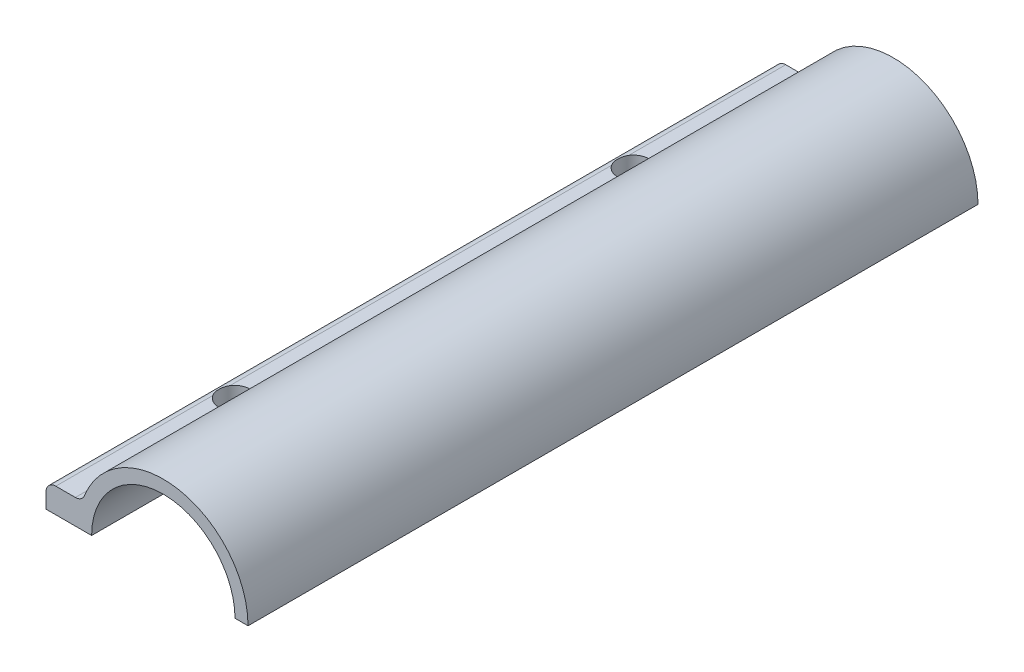
from build123d import *

# Parameters (mm, degrees)
BOSS_EXTRUDE1_DEPTH           = 112
SKETCH6_W                     = 2.4
SKETCH6_H                     = 3.81
M4_CLEARANCE_HOLE2_AT_2_COUNT = 2
M4_CLEARANCE_HOLE2_AT_2_PITCH = 61.2
SKETCH7_R                     = 4
CUT_EXTRUDE1_DEPTH            = 114.80885774
FILLET1_R                     = 1.5


with BuildPart() as part:
    # Sketch1 → Boss-Extrude1 (new body)
    with BuildSketch(Plane.XY):
        with BuildLine():
            ThreePointArc((-12.429155241, 3.81), (-12.856496765, 1.926263465), (-13, 0))
            Line((-13, 0), (-11, 0))
            ThreePointArc((-11, 0), (0, 11), (11, 0))
            Line((11, 0), (13, 0))
            ThreePointArc((13, 0), (9.192388155, 9.192388155), (0, 13))
            ThreePointArc((0, 13), (-7.728842087, 10.452990003), (-12.429155241, 3.81))
        make_face()
        with BuildLine():
            Line((-18, 0), (-13, 0))
            ThreePointArc((-13, 0), (-12.856496765, 1.926263465), (-12.429155241, 3.81))
            Line((-12.429155241, 3.81), (-18, 3.81))
            Line((-18, 3.81), (-18, 0))
        make_face()
    extrude(amount=BOSS_EXTRUDE1_DEPTH)

    # Sketch6 → M4 Clearance Hole2 (revolve, cut)
    with BuildSketch(Plane(origin=(-14.5, 3.81, 86.6), x_dir=(0, 0, 1), z_dir=(1, 0, 0))):
        with Locations((1.2, 1.905)):
            Rectangle(SKETCH6_W, SKETCH6_H)
    m4_clearance_hole2 = revolve(axis=Axis((-14.5, 10.16, 86.6), (0, -1, 0)), mode=Mode.SUBTRACT)

    # M4 Clearance Hole2 at 2: M4 Clearance Hole2 ×2
    with Locations(*[(0, 0, -i * M4_CLEARANCE_HOLE2_AT_2_PITCH) for i in range(1, M4_CLEARANCE_HOLE2_AT_2_COUNT)]):
        add(m4_clearance_hole2, mode=Mode.SUBTRACT)

    # Sketch7 → Cut-Extrude1 (cut, through all)
    with BuildSketch(Plane(origin=(0, 3.81, 0), x_dir=(1, 0, 0), z_dir=(0, 1, 0))):
        with Locations((-14.5, -25.4)):
            Circle(SKETCH7_R)
        with Locations((-14.5, -86.6)):
            Circle(SKETCH7_R)
    extrude(amount=CUT_EXTRUDE1_DEPTH, mode=Mode.SUBTRACT)

    # Fillet1
    # the kernel refuses this fillet: 1.5 mm, written as the material it adds along each edge
    with BuildSketch(Plane(origin=(-12.429155241, 3.81, 87.363272187), x_dir=(0.32988946400333646, 0.9440195662906523, 0), z_dir=(0, 0, 1))) as fillet1_piece_1_section:
        with BuildLine():
            CenterArc((1.065165566, 1.498874377), FILLET1_R, 199.262066546, 68.518123934)
            Line((-0.350863784, 1.004040181), (0, 0))
            ThreePointArc((0, 0), (0.503532813, 0.009755402), (1.007065626, 0))
        make_face()
    fillet1_piece_1 = extrude(amount=24.636727813, mode=Mode.PRIVATE)
    fillet1_piece_1 = fillet1_piece_1 - Plane(origin=(-14.5, 4.019727469, 86.6), x_dir=(1, 0, 0), z_dir=(0, -1, 0)) * Cylinder(4, 54, mode=Mode.PRIVATE)
    add(fillet1_piece_1)
    with BuildSketch(Plane(origin=(-12.429155241, 3.81, 26.163272187), x_dir=(0.32988946400333646, 0.9440195662906523, 0), z_dir=(0, 0, 1))) as fillet1_piece_2_section:
        with BuildLine():
            CenterArc((1.065165566, 1.498874377), FILLET1_R, 199.262066546, 68.518123934)
            Line((-0.350863784, 1.004040181), (0, 0))
            ThreePointArc((0, 0), (0.503532813, 0.009755402), (1.007065626, 0))
        make_face()
    fillet1_piece_2 = extrude(amount=59.673455626, mode=Mode.PRIVATE)
    fillet1_piece_2 = fillet1_piece_2 - Plane(origin=(-14.5, 4.019506005, 86.6), x_dir=(1, 0, 0), z_dir=(0, -1, 0)) * Cylinder(4, 124, mode=Mode.PRIVATE)
    fillet1_piece_2 = fillet1_piece_2 - Plane(origin=(-14.5, 4.019506005, 25.4), x_dir=(1, 0, 0), z_dir=(0, -1, 0)) * Cylinder(4, 124, mode=Mode.PRIVATE)
    add(fillet1_piece_2)
    with BuildSketch(Plane(origin=(-12.429155241, 3.81, 0), x_dir=(0.3298894640033357, 0.9440195662906526, 0), z_dir=(0, 0, 1))) as fillet1_piece_3_section:
        with BuildLine():
            CenterArc((1.065165566, 1.498874377), FILLET1_R, 199.262066546, 68.518123934)
            Line((-0.350863784, 1.004040181), (0, 0))
            ThreePointArc((0, 0), (0.503532813, 0.009755402), (1.007065626, 0))
        make_face()
    fillet1_piece_3 = extrude(amount=24.636727813, mode=Mode.PRIVATE)
    fillet1_piece_3 = fillet1_piece_3 - Plane(origin=(-14.5, 4.019727315, 25.4), x_dir=(1, 0, 0), z_dir=(0, -1, 0)) * Cylinder(4, 54, mode=Mode.PRIVATE)
    add(fillet1_piece_3)
    # the kernel refuses this fillet: 1.5 mm, written as the material it takes off along each edge
    with BuildSketch(Plane(origin=(-18, 3.81, -3.75), x_dir=(1, 0, 0), z_dir=(0, 0, 1))) as fillet1_2_piece_1:
        with BuildLine():
            CenterArc((FILLET1_R, -FILLET1_R), FILLET1_R, 90, 90)
            Line((0, -FILLET1_R), (0, 0))
            Line((0, 0), (FILLET1_R, 0))
        make_face()
    extrude(amount=119.5, mode=Mode.SUBTRACT)


solid = part.part
